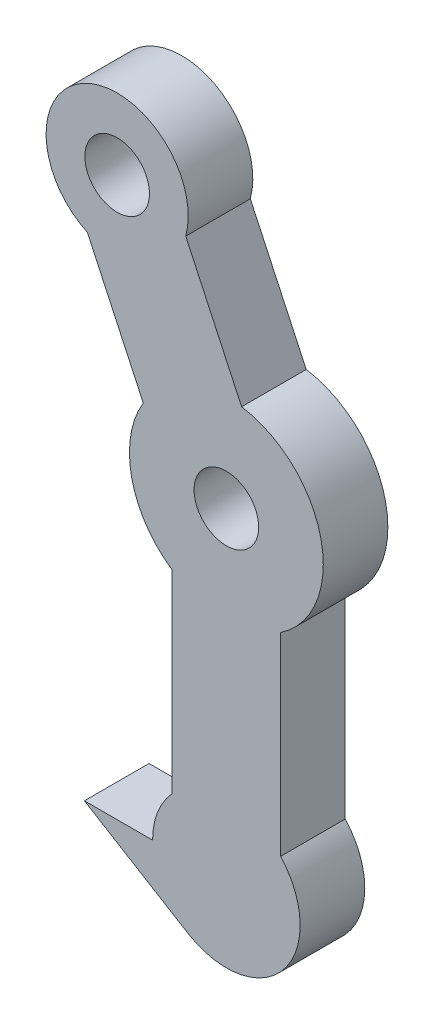
from build123d import *

# Parameters (mm, degrees)
SKETCH1_R           = 3.175
BOSS_EXTRUDE1_DEPTH = 3.175


with BuildPart() as part:
    # Sketch1 → Boss-Extrude1 (new, symmetric)
    with BuildSketch(Plane.XY):
        with BuildLine():
            Line((1.499199331, 9.406275903), (-3.9943168, 21.187159265))
            ThreePointArc((-3.9943168, 21.187159265), (-13.686492406, 29.350777683), (-13.662808272, 16.678667649))
            Line((-13.662808272, 16.678667649), (-8.169292141, 4.897784287))
            ThreePointArc((-8.169292141, 4.897784287), (-9.299219468, -2.061587323), (-5.334, -7.891392083))
            Line((-5.334, -7.891392083), (-5.334, -26.941392083))
            ThreePointArc((-5.334, -26.941392083), (-6.756471213, -29.218262834), (-7.253317308, -31.856578343))
            Line((-7.253317308, -31.856578343), (-13.951362574, -31.856578343))
            Line((-13.951362574, -31.856578343), (-3.771001699, -38.052557536))
            ThreePointArc((-3.771001699, -38.052557536), (5.610279882, -36.453900566), (5.334, -26.941392083))
            Line((5.334, -26.941392083), (5.334, -7.891392083))
            ThreePointArc((5.334, -7.891392083), (9.299219468, 2.061587323), (1.499199331, 9.406275903))
        make_face()
        with Locations((-10.734503848, 23.020217791)):
            Circle(SKETCH1_R, mode=Mode.SUBTRACT)
        Circle(SKETCH1_R, mode=Mode.SUBTRACT)
    extrude(amount=BOSS_EXTRUDE1_DEPTH, both=True)


solid = part.part
